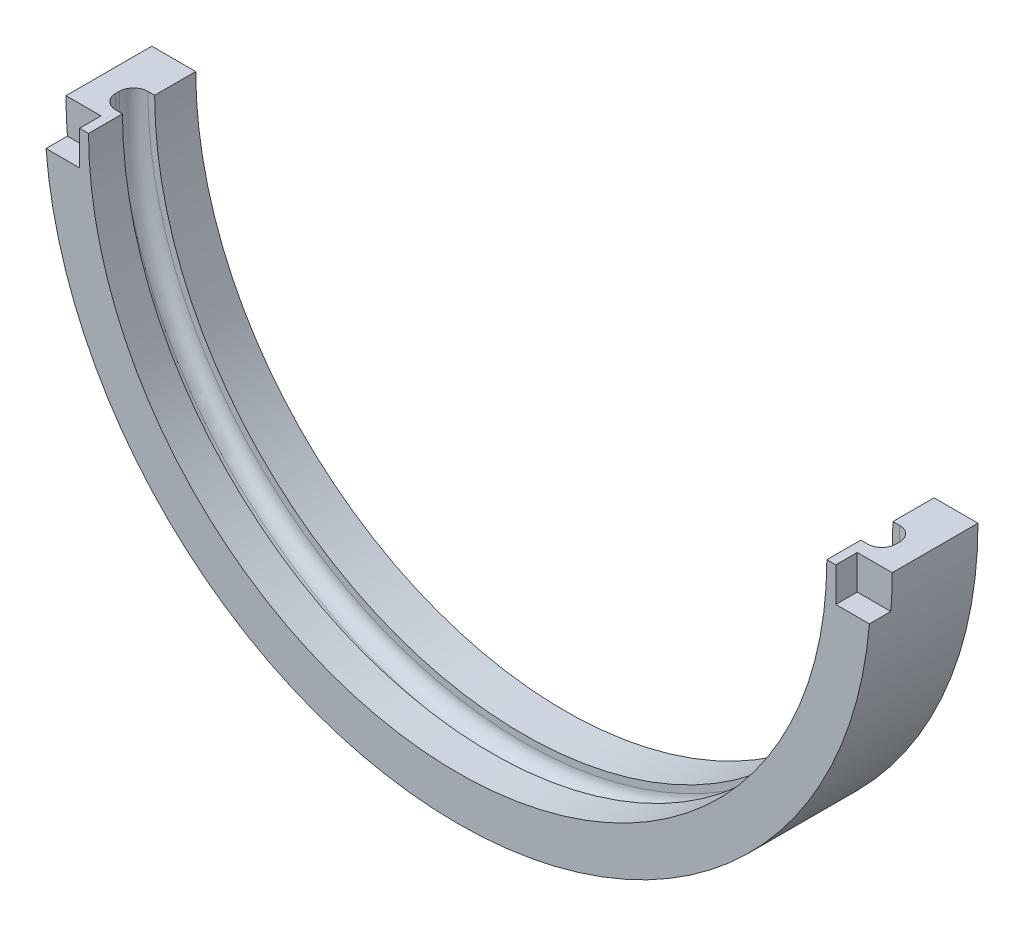
from build123d import *

# Parameters (mm, degrees)
BOSS_EXTRUDE1_DEPTH = 5.715
BOSS_EXTRUDE2_DEPTH = 6.0325
BOSS_EXTRUDE3_START = 7.3025
BOSS_EXTRUDE3_DEPTH = 7.3025
FILLET1_R           = 2.54
SKETCH6_W           = 6.645493415
SKETCH6_H           = 6.096
CUT_EXTRUDE5_DEPTH  = 3.81


with BuildPart() as part:
    # Sketch1 → Boss-Extrude1 (new body)
    with BuildSketch(Plane.XY):
        with BuildLine():
            ThreePointArc((69.342, 73.406), (0, 4.064), (-69.342, 73.406))
            Line((-69.342, 73.406), (-73.406, 73.406))
            ThreePointArc((-73.406, 73.406), (0, 0), (73.406, 73.406))
            Line((73.406, 73.406), (69.342, 73.406))
        make_face()
    extrude(amount=BOSS_EXTRUDE1_DEPTH)

    # Sketch3 → Boss-Extrude2 (add)
    with BuildSketch(Plane.XY.offset(5.715)):
        with BuildLine():
            ThreePointArc((65.5955, 73.406), (0, 7.8105), (-65.5955, 73.406))
            Line((-65.5955, 73.406), (-73.406, 73.406))
            ThreePointArc((-73.406, 73.406), (0, 0), (73.406, 73.406))
            Line((73.406, 73.406), (65.5955, 73.406))
        make_face()
    extrude(amount=BOSS_EXTRUDE2_DEPTH)

    # Sketch4 → Boss-Extrude3 (add)
    with BuildSketch(Plane(origin=(0, 0, 0), x_dir=(-1, 0, 0), z_dir=(0, 0, -1)).offset(BOSS_EXTRUDE3_START)):
        with BuildLine():
            ThreePointArc((65.5955, 73.406), (0, 7.8105), (-65.5955, 73.406))
            Line((-65.5955, 73.406), (-73.406, 73.406))
            ThreePointArc((-73.406, 73.406), (0, 0), (73.406, 73.406))
            Line((73.406, 73.406), (65.5955, 73.406))
        make_face()
    extrude(amount=-BOSS_EXTRUDE3_DEPTH)

    # Fillet1
    fillet1_edges = [part.edges().sort_by_distance(p)[0] for p in [
        (0, 4.064, 5.715),
        (0, 4.064, 0),
    ]]
    fillet(fillet1_edges, radius=FILLET1_R)

    # Sketch6 → Cut-Extrude5 (cut)
    with BuildSketch(Plane.XY.offset(11.7475)):
        with Locations((-70.506627119, 70.358)):
            Rectangle(SKETCH6_W, SKETCH6_H)
        with Locations((70.506627119, 70.358)):
            Rectangle(SKETCH6_W, SKETCH6_H)
    extrude(amount=-CUT_EXTRUDE5_DEPTH, mode=Mode.SUBTRACT)


solid = part.part
